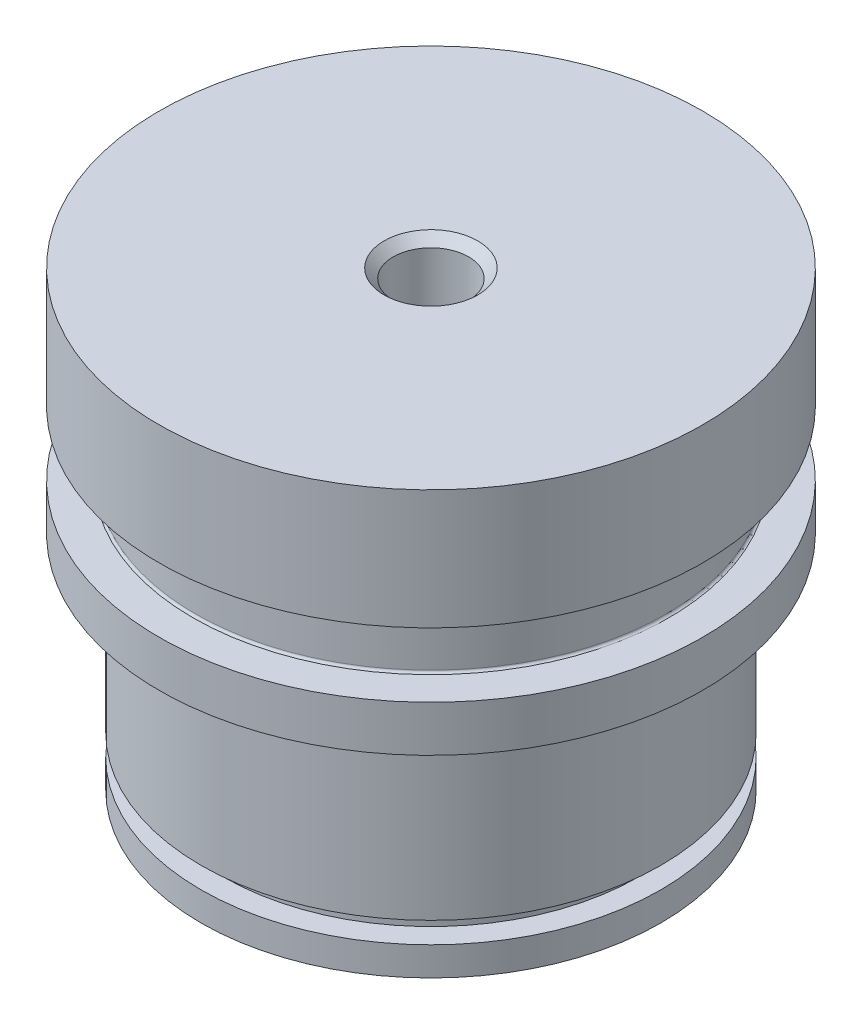
from build123d import *

# Parameters (mm, degrees)
FILLET4_R     = 0.127
FILLET1_R     = 0.5
FILLET2_R     = 2
CHAMFER4_SIZE = 0.508


with BuildPart() as part:
    # Sketch1 → Revolve1 (revolve)
    with BuildSketch(Plane.XY, mode=Mode.PRIVATE) as revolve1_sk:
        Polygon((-10.16, 0), (-12.7, 0), (-12.7, 1.5875), (-11.4681, 1.5875), (-11.4681, 2.7559), (-12.7, 2.7559), (-12.7, 12.2809), (-15.0114, 12.2809), (-15.0114, 14.8209), (-13.0175, 14.8209), (-13.0175, 18.3769), (-15.0114, 18.3769), (-15.0114, 24.9809), (-10.16, 24.9809), (0, 24.9809), (0, 0), align=None)
    revolve(revolve1_sk.sketch.rotate(Axis((0, 0, 0), (0, 1, 0)), 270), axis=Axis((0, 0, 0), (0, 1, 0)))

    # Fillet4
    fillet4_edges = [part.edges().sort_by_distance(p)[0] for p in [
        (0, 18.3769, 13.0175),
        (0, 14.8209, 13.0175),
    ]]
    fillet(fillet4_edges, radius=FILLET4_R)

    # Sketch9 → Cut-Revolve2 (revolve, cut)
    with BuildSketch(Plane.XY, mode=Mode.PRIVATE) as cut_revolve2_sk:
        Polygon((10.25, 0), (9.499743762, 2.7999944), (9.499743762, 4.0699944), (10, 4.0699944), (10, 5.1699944), (9.525, 5.1699944), (9.525, 10.5039944), (0.396875, 10.5039944), (0.396875, 24.9809), (0, 24.9809), (0, 0), align=None)
    revolve(cut_revolve2_sk.sketch.rotate(Axis((0, 0, 0), (0, 1, 0)), 90), axis=Axis((0, 0, 0), (0, 1, 0)), mode=Mode.SUBTRACT)

    # Fillet1
    # the kernel refuses this fillet: 0.5 mm, written as the material it takes off along each edge
    with BuildSketch(Plane(origin=(0, 0, 0), x_dir=(0, 0, -1), z_dir=(1, 0, 0))) as fillet1_piece_1:
        with BuildLine():
            CenterArc((10.25 + FILLET1_R * 0.767326987979, FILLET1_R), FILLET1_R, 195, 75)
            Line((10.25 - FILLET1_R * 0.19859883831, FILLET1_R * 0.741180954897), (10.25, 0))
            Line((10.25, 0), (10.25 + FILLET1_R * 0.767326987979, 0))
        make_face()
    revolve(axis=Axis((0, 0, 0), (0, 1, 0)), mode=Mode.SUBTRACT)
    with BuildSketch(Plane(origin=(0, 5.1699944, 0), x_dir=(0, 0, -1), z_dir=(1, 0, 0))) as fillet1_piece_2_section:
        with BuildLine():
            CenterArc((9.525 + FILLET1_R, FILLET1_R), FILLET1_R, 180, 90)
            Line((9.525 + FILLET1_R, 0), (9.525, 0))
            Line((9.525, 0), (9.525, FILLET1_R))
        make_face()
    fillet1_piece_2 = revolve(axis=Axis((0, 5.1699944, 0), (0, 1, 0)), mode=Mode.PRIVATE)
    fillet1_piece_2 = fillet1_piece_2 & Plane(origin=(0, 5.314596345, 0), x_dir=(0, 0, -1), z_dir=(0, 1, 0)) * Cylinder(10, 41, mode=Mode.PRIVATE)
    add(fillet1_piece_2, mode=Mode.SUBTRACT)

    # Fillet2
    fillet2_edges = [part.edges().sort_by_distance(p)[0] for p in [
        (0, 2.7999944, 9.499743762),
    ]]
    fillet(fillet2_edges, radius=FILLET2_R)

    # Sketch11 → Upchurch Cone Fitting (revolve, cut)
    with BuildSketch(Plane.XY, mode=Mode.PRIVATE) as upchurch_cone_fitting_sk:
        Polygon((0.508, 14.5669), (0.508, 10.5039944), (0, 10.5039944), (0, 24.9809), (2.08066419, 24.9809), (2.08066419, 18.6817), (1.6002, 18.39300799), (0.8509, 16.334323159), (0.8509, 14.5669), align=None)
    revolve(upchurch_cone_fitting_sk.sketch.rotate(Axis((0, 0, 0), (0, 1, 0)), 90), axis=Axis((0, 0, 0), (0, 1, 0)), mode=Mode.SUBTRACT)

    # Chamfer4
    chamfer4_edges = [part.edges().sort_by_distance(p)[0] for p in [
        (0, 24.9809, 2.08066419),
    ]]
    chamfer(chamfer4_edges, length=CHAMFER4_SIZE)


solid = part.part
